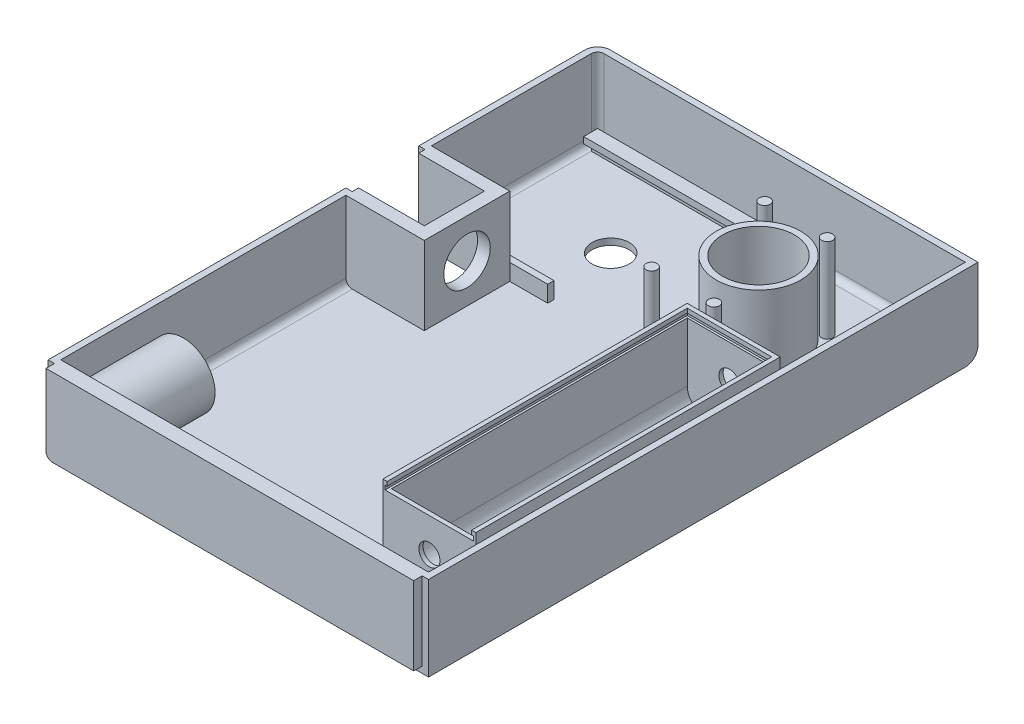
from build123d import *

# Parameters (mm, degrees)
SKETCH1_W            = 90
SKETCH1_H            = 130
BOSS_EXTRUDE1_DEPTH  = 20
FILLET1_R            = 3
SHELL1_T             = -1.5
SKETCH2_W            = 26
SKETCH2_H            = 1.5
SKETCH2_W_2          = 46
SKETCH2_H_2          = 3.3
BOSS_EXTRUDE2_DEPTH  = 3.9
CUT_EXTRUDE1_DEPTH   = 46
SKETCH6_R            = 4.4
CUT_EXTRUDE3_DEPTH   = 1.5
SKETCH8_R            = 10
SKETCH8_R_2          = 8.5
SKETCH8_R_3          = 1.3
BOSS_EXTRUDE7_DEPTH  = 20
CUT_EXTRUDE5_START   = -21.5
SKETCH16_R           = 8.5
CUT_EXTRUDE5_DEPTH   = 21.5
BOSS_EXTRUDE8_START  = -3
SKETCH17_R           = 10
BOSS_EXTRUDE8_DEPTH  = 3
SKETCH18_R           = 10.008571274
CUT_EXTRUDE6_DEPTH   = 3
SKETCH19_R           = 8.5
BOSS_EXTRUDE12_DEPTH = 1
SKETCH20_R           = 1
BOSS_EXTRUDE15_DEPTH = 5.5
SKETCH21_R           = 0.7
BOSS_EXTRUDE16_DEPTH = 3
SKETCH22_W           = 12
SKETCH22_H           = 15.5
CUT_EXTRUDE8_DEPTH   = 0.5
SKETCH23_W           = 15
SKETCH23_H           = 18.5
SKETCH23_W_2         = 12.5
SKETCH23_H_2         = 16
BOSS_EXTRUDE22_DEPTH = 1.5
SKETCH24_W           = 2
SKETCH24_H           = 0.9375
CUT_EXTRUDE11_DEPTH  = 1
SKETCH25_W           = 21.978502557
SKETCH25_H           = 72
SKETCH25_W_2         = 19.978502557
SKETCH25_H_2         = 70
BOSS_EXTRUDE25_DEPTH = 20
FILLET2_R            = 4
CUT_EXTRUDE12_REACH  = 191.679
SKETCH31_R           = 2.5
CUT_EXTRUDE13_REACH  = 174.61
SKETCH32_R           = 2.5
SKETCH34_W           = 20
SKETCH34_H           = 1
CUT_EXTRUDE14_DEPTH  = 2
SKETCH35_W           = 71
SKETCH35_H           = 1
CUT_EXTRUDE15_DEPTH  = 0.5
SKETCH36_W           = 1
SKETCH36_H           = 2
BOSS_EXTRUDE34_DEPTH = 0.021497443
SKETCH38_W           = 71
SKETCH38_H           = 1
CUT_EXTRUDE16_DEPTH  = 0.5
SKETCH39_W           = 20.978502557
SKETCH39_H           = 1
CUT_EXTRUDE17_DEPTH  = 0.5
SKETCH42_R           = 7.5
SKETCH42_R_2         = 6.5
BOSS_EXTRUDE35_DEPTH = 20
SKETCH45_W           = 20
SKETCH45_H           = 17
CUT_EXTRUDE19_DEPTH  = 1.5
SKETCH48_W           = 20.040080506
SKETCH48_H           = 20.038736818
CUT_EXTRUDE20_DEPTH  = 182.842929215
SKETCH49_W           = 20.040080506
SKETCH49_H           = 20
CUT_EXTRUDE22_DEPTH  = 0.184579226
SKETCH52_W           = 20.040080506
SKETCH52_H           = 20.223316044
BOSS_EXTRUDE37_DEPTH = 20
SKETCH54_W           = 18.540080506
SKETCH54_H           = 17.223316044
CUT_EXTRUDE23_DEPTH  = 20
FILLET8_R            = 3
FILLET9_R            = 3
BOSS_EXTRUDE39_DEPTH = 1
SKETCH57_W           = 15.540080506
SKETCH57_H           = 1
BOSS_EXTRUDE40_DEPTH = 1.5
SKETCH58_W           = 17.223316044
SKETCH58_H           = 18.5
BOSS_EXTRUDE41_DEPTH = 1.5
BOSS_EXTRUDE42_START = 1.5
BOSS_EXTRUDE42_DEPTH = 1.5
SKETCH62_W           = 14.040080506
SKETCH62_H           = 1.5
BOSS_EXTRUDE43_DEPTH = 1.5
SKETCH66_W           = 1.5
SKETCH66_H           = 18.5
BOSS_EXTRUDE44_DEPTH = 1.5
SKETCH67_W           = 0.75
SKETCH67_H           = 6
CUT_EXTRUDE24_DEPTH  = 1
FILLET10_R           = 0.25
BOSS_EXTRUDE45_DEPTH = 0.5
CUT_EXTRUDE26_REACH  = 130.535
SKETCH70_R           = 5.5
BOSS_EXTRUDE48_DEPTH = 2
SKETCH74_W           = 87
SKETCH74_H           = 2
BOSS_EXTRUDE49_DEPTH = 1.5


with BuildPart() as part:
    # Sketch1 → Boss-Extrude1 (new body)
    with BuildSketch(Plane(origin=(0, 0, 0), x_dir=(1, 0, 0), z_dir=(0, 1, 0))):
        with Locations((-103.28562659, 38.614544598)):
            Rectangle(SKETCH1_W, SKETCH1_H)
    extrude(amount=BOSS_EXTRUDE1_DEPTH)

    # Fillet1
    fillet1_edges = [part.edges().sort_by_distance(p)[0] for p in [
        (-148.28562659, 0, -38.614544598),
        (-103.28562659, 0, -103.614544598),
        (-148.28562659, 10, -103.614544598),
    ]]
    fillet(fillet1_edges, radius=FILLET1_R)

    # Shell1
    shell1_openings = [part.faces().sort_by_distance(p)[0] for p in [
        (-103.278307477, 20, -38.603923372),
    ]]
    offset(amount=SHELL1_T, openings=shell1_openings, kind=Kind.INTERSECTION)

    # Sketch2 → Boss-Extrude2 (add)
    with BuildSketch(Plane(origin=(0, 1.5, 0), x_dir=(1, 0, 0), z_dir=(0, 1, 0))):
        with Locations((-132.28562659, 63.549123824)):
            Rectangle(SKETCH2_W, SKETCH2_H)
        with Locations((-122.28562659, 98.964544598)):
            Rectangle(SKETCH2_W_2, SKETCH2_H_2)
    extrude(amount=BOSS_EXTRUDE2_DEPTH)

    # 3DSketch3 → Cut-Extrude1 (cut)
    with BuildSketch(Plane(origin=(-99.28562659, 3.9, -97.314544598), x_dir=(0, -0.8000000000000006, -0.5999999999999991), z_dir=(-1, 0, 0))):
        Polygon((0, 0), (1.92, 1.44), (3, 0), (1.08, -1.44), align=None)
    extrude(amount=CUT_EXTRUDE1_DEPTH, mode=Mode.SUBTRACT)

    # Sketch6 → Cut-Extrude3 (cut)
    with BuildSketch(Plane(origin=(0, 1.5, 0), x_dir=(1, 0, 0), z_dir=(0, 1, 0))):
        with Locations(Location((-122.08562659, 80.508056887, 0), (0, 0, 270))):
            Circle(SKETCH6_R)
    extrude(amount=-CUT_EXTRUDE3_DEPTH, mode=Mode.SUBTRACT)

    # Sketch8 → Boss-Extrude7 (add)
    # profile 1 of 5: a face of its own
    with BuildSketch(Plane(origin=(0, 1.5, 0), x_dir=(1, 0, 0), z_dir=(0, 1, 0))):
        with Locations(Location((-87.1062965, 80.508056887, 0), (0, 0, 90))):
            Circle(SKETCH8_R)
        with Locations(Location((-87.1062965, 80.508056887, 0), (0, 0, 270))):
            Circle(SKETCH8_R_2, mode=Mode.SUBTRACT)
    # profile 2 of 5: a face of its own
    with BuildSketch(Plane(origin=(0, 1.5, 0), x_dir=(1, 0, 0), z_dir=(0, 1, 0))):
        with Locations(Location((-94.564129147, 89.408056887, 0), (0, 0, 90))):
            Circle(SKETCH8_R_3)
    # profile 3 of 5: a face of its own
    with BuildSketch(Plane(origin=(0, 1.5, 0), x_dir=(1, 0, 0), z_dir=(0, 1, 0))):
        with Locations(Location((-79.764129147, 89.408056887, 0), (0, 0, 90))):
            Circle(SKETCH8_R_3)
    # profile 4 of 5: a face of its own
    with BuildSketch(Plane(origin=(0, 1.5, 0), x_dir=(1, 0, 0), z_dir=(0, 1, 0))):
        with Locations(Location((-94.502718272, 62.608056887, 0), (0, 0, 90))):
            Circle(SKETCH8_R_3)
    # profile 5 of 5: a face of its own
    with BuildSketch(Plane(origin=(0, 1.5, 0), x_dir=(1, 0, 0), z_dir=(0, 1, 0))):
        with Locations(Location((-79.764129147, 62.608056887, 0), (0, 0, 90))):
            Circle(SKETCH8_R_3)
    extrude(amount=BOSS_EXTRUDE7_DEPTH)

    # Sketch16 → Cut-Extrude5 (cut)
    with BuildSketch(Plane(origin=(0, 21.5, 0), x_dir=(1, 0, 0), z_dir=(0, 1, 0)).offset(CUT_EXTRUDE5_START)):
        with Locations(Location((-87.1062965, 80.508056887, 0), (0, 0, 90))):
            Circle(SKETCH16_R)
    extrude(amount=CUT_EXTRUDE5_DEPTH, mode=Mode.SUBTRACT)

    # Sketch17 → Boss-Extrude8 (add)
    with BuildSketch(Plane(origin=(0, 21.5, 0), x_dir=(1, 0, 0), z_dir=(0, 1, 0)).offset(BOSS_EXTRUDE8_START)):
        with Locations(Location((-87.1062965, 80.508056887, 0), (0, 0, 90))):
            Circle(SKETCH17_R)
    extrude(amount=BOSS_EXTRUDE8_DEPTH)

    # Sketch18 → Cut-Extrude6 (cut)
    with BuildSketch(Plane(origin=(0, 21.5, 0), x_dir=(1, 0, 0), z_dir=(0, 1, 0))):
        with Locations((-87.1062965, 80.508056887)):
            Circle(SKETCH18_R)
    extrude(amount=-CUT_EXTRUDE6_DEPTH, mode=Mode.SUBTRACT)

    # Sketch19 → Boss-Extrude12 (add)
    # profile 1 of 9: a face of its own
    with BuildSketch(Plane.XZ):
        with Locations(Location((-87.1062965, -80.508056887, 0), (0, 0, 270))):
            Circle(SKETCH19_R)
        with BuildLine():
            Line((-81.857714187, -84.342425637), (-84.692082937, -81.508056887))
            Line((-84.692082937, -81.508056887), (-80.68368021, -81.508056887))
            ThreePointArc((-80.68368021, -81.508056887), (-81.101079538, -82.995499197), (-81.857714187, -84.342425637))
        make_face(mode=Mode.SUBTRACT)
        with BuildLine():
            Line((-83.27192775, -85.756639199), (-86.1062965, -82.922270449))
            Line((-86.1062965, -82.922270449), (-86.1062965, -86.930673176))
            ThreePointArc((-86.1062965, -86.930673176), (-84.618854189, -86.513273848), (-83.27192775, -85.756639199))
        make_face(mode=Mode.SUBTRACT)
        with BuildLine():
            Line((-88.1062965, -86.930673176), (-88.1062965, -82.922270449))
            Line((-88.1062965, -82.922270449), (-90.94066525, -85.756639199))
            ThreePointArc((-90.94066525, -85.756639199), (-89.59373881, -86.513273848), (-88.1062965, -86.930673176))
        make_face(mode=Mode.SUBTRACT)
        with BuildLine():
            Line((-84.692082937, -79.508056887), (-80.68368021, -79.508056887))
            ThreePointArc((-80.68368021, -79.508056887), (-81.101079538, -78.020614576), (-81.857714187, -76.673688137))
            Line((-81.857714187, -76.673688137), (-84.692082937, -79.508056887))
        make_face(mode=Mode.SUBTRACT)
        with BuildLine():
            Line((-92.354878812, -84.342425637), (-89.520510062, -81.508056887))
            Line((-89.520510062, -81.508056887), (-93.528912789, -81.508056887))
            ThreePointArc((-93.528912789, -81.508056887), (-93.111513461, -82.995499197), (-92.354878812, -84.342425637))
        make_face(mode=Mode.SUBTRACT)
        with BuildLine():
            Line((-86.1062965, -74.085440597), (-86.1062965, -78.093843324))
            Line((-86.1062965, -78.093843324), (-83.27192775, -75.259474574))
            ThreePointArc((-83.27192775, -75.259474574), (-84.618854189, -74.502839925), (-86.1062965, -74.085440597))
        make_face(mode=Mode.SUBTRACT)
        with BuildLine():
            Line((-90.94066525, -75.259474574), (-88.1062965, -78.093843324))
            Line((-88.1062965, -78.093843324), (-88.1062965, -74.085440597))
            ThreePointArc((-88.1062965, -74.085440597), (-89.59373881, -74.502839925), (-90.94066525, -75.259474574))
        make_face(mode=Mode.SUBTRACT)
        with BuildLine():
            Line((-92.354878812, -76.673688137), (-89.520510062, -79.508056887))
            Line((-89.520510062, -79.508056887), (-93.528912789, -79.508056887))
            ThreePointArc((-93.528912789, -79.508056887), (-93.111513461, -78.020614576), (-92.354878812, -76.673688137))
        make_face(mode=Mode.SUBTRACT)
    # profile 2 of 9: a face of its own
    with BuildSketch(Plane.XZ):
        with BuildLine():
            Line((-80.857714187, -3.83436875), (-83.692082937, -1))
            Line((-83.692082937, -1), (-79.68368021, -1))
            ThreePointArc((-79.68368021, -1), (-80.101079538, -2.48744231), (-80.857714187, -3.83436875))
        make_face()
    # profile 3 of 9: a face of its own
    with BuildSketch(Plane.XZ):
        with BuildLine():
            Line((-82.27192775, -5.248582312), (-85.1062965, -2.414213562))
            Line((-85.1062965, -2.414213562), (-85.1062965, -6.422616289))
            ThreePointArc((-85.1062965, -6.422616289), (-83.618854189, -6.005216961), (-82.27192775, -5.248582312))
        make_face()
    # profile 4 of 9: a face of its own
    with BuildSketch(Plane.XZ):
        with BuildLine():
            Line((-87.1062965, -6.422616289), (-87.1062965, -2.414213562))
            Line((-87.1062965, -2.414213562), (-89.94066525, -5.248582312))
            ThreePointArc((-89.94066525, -5.248582312), (-88.59373881, -6.005216961), (-87.1062965, -6.422616289))
        make_face()
    # profile 5 of 9: a face of its own
    with BuildSketch(Plane.XZ):
        with BuildLine():
            Line((-83.692082937, 1), (-79.68368021, 1))
            ThreePointArc((-79.68368021, 1), (-80.101079538, 2.48744231), (-80.857714187, 3.83436875))
            Line((-80.857714187, 3.83436875), (-83.692082937, 1))
        make_face()
    # profile 6 of 9: a face of its own
    with BuildSketch(Plane.XZ):
        with BuildLine():
            Line((-91.354878812, -3.83436875), (-88.520510062, -1))
            Line((-88.520510062, -1), (-92.528912789, -1))
            ThreePointArc((-92.528912789, -1), (-92.111513461, -2.48744231), (-91.354878812, -3.83436875))
        make_face()
    # profile 7 of 9: a face of its own
    with BuildSketch(Plane.XZ):
        with BuildLine():
            Line((-85.1062965, 6.422616289), (-85.1062965, 2.414213562))
            Line((-85.1062965, 2.414213562), (-82.27192775, 5.248582312))
            ThreePointArc((-82.27192775, 5.248582312), (-83.618854189, 6.005216961), (-85.1062965, 6.422616289))
        make_face()
    # profile 8 of 9: a face of its own
    with BuildSketch(Plane.XZ):
        with BuildLine():
            Line((-89.94066525, 5.248582312), (-87.1062965, 2.414213562))
            Line((-87.1062965, 2.414213562), (-87.1062965, 6.422616289))
            ThreePointArc((-87.1062965, 6.422616289), (-88.59373881, 6.005216961), (-89.94066525, 5.248582312))
        make_face()
    # profile 9 of 9: a face of its own
    with BuildSketch(Plane.XZ):
        with BuildLine():
            Line((-91.354878812, 3.83436875), (-88.520510062, 1))
            Line((-88.520510062, 1), (-92.528912789, 1))
            ThreePointArc((-92.528912789, 1), (-92.111513461, 2.48744231), (-91.354878812, 3.83436875))
        make_face()
    extrude(amount=-BOSS_EXTRUDE12_DEPTH)

    # Sketch20 → Boss-Extrude15 (add)
    with BuildSketch(Plane(origin=(0, 1.5, 0), x_dir=(1, 0, 0), z_dir=(0, 1, 0))):
        with Locations(Location((-69.077904332, 76.031555544, 0), (0, 0, 90))):
            Circle(SKETCH20_R)
    extrude(amount=BOSS_EXTRUDE15_DEPTH)

    # Sketch21 → Boss-Extrude16 (add)
    with BuildSketch(Plane(origin=(0, 7, 0), x_dir=(1, 0, 0), z_dir=(0, 1, 0))):
        with Locations(Location((-69.077904332, 76.031555544, 0), (0, 0, 270))):
            Circle(SKETCH21_R)
    extrude(amount=BOSS_EXTRUDE16_DEPTH)

    # Sketch22 → Cut-Extrude8 (cut)
    with BuildSketch(Plane(origin=(0, 1.5, 0), x_dir=(1, 0, 0), z_dir=(0, 1, 0))):
        with Locations((-69.119914463, 89.382246848)):
            Rectangle(SKETCH22_W, SKETCH22_H)
    extrude(amount=-CUT_EXTRUDE8_DEPTH, mode=Mode.SUBTRACT)

    # Sketch23 → Boss-Extrude22 (add)
    with BuildSketch(Plane(origin=(0, 1.5, 0), x_dir=(1, 0, 0), z_dir=(0, 1, 0))):
        with Locations((-69.119914463, 89.382246848)):
            Rectangle(SKETCH23_W, SKETCH23_H)
        with Locations((-69.119914463, 89.382246848)):
            Rectangle(SKETCH23_W_2, SKETCH23_H_2, mode=Mode.SUBTRACT)
    extrude(amount=BOSS_EXTRUDE22_DEPTH)

    # Sketch24 → Cut-Extrude11 (cut)
    with BuildSketch(Plane(origin=(0, 1, 0), x_dir=(1, 0, 0), z_dir=(0, 1, 0))):
        with Locations((-70.619914463, 96.163496848)):
            Rectangle(SKETCH24_W, SKETCH24_H)
        with Locations((-64.619914463, 96.163496848)):
            Rectangle(SKETCH24_W, SKETCH24_H)
        with Locations((-70.619914463, 94.225996848)):
            Rectangle(SKETCH24_W, SKETCH24_H)
        with Locations((-64.619914463, 94.225996848)):
            Rectangle(SKETCH24_W, SKETCH24_H)
        with Locations((-64.619914463, 92.288496848)):
            Rectangle(SKETCH24_W, SKETCH24_H)
        with Locations((-64.619914463, 90.350996848)):
            Rectangle(SKETCH24_W, SKETCH24_H)
        with Locations((-67.619914463, 92.288496848)):
            Rectangle(SKETCH24_W, SKETCH24_H)
        with Locations((-67.619914463, 90.350996848)):
            Rectangle(SKETCH24_W, SKETCH24_H)
        with Locations((-67.619914463, 96.163496848)):
            Rectangle(SKETCH24_W, SKETCH24_H)
        with Locations((-67.619914463, 94.225996848)):
            Rectangle(SKETCH24_W, SKETCH24_H)
        with Locations((-70.619914463, 92.288496848)):
            Rectangle(SKETCH24_W, SKETCH24_H)
        with Locations((-70.619914463, 90.350996848)):
            Rectangle(SKETCH24_W, SKETCH24_H)
        with Locations((-73.619914463, 90.350996848)):
            Rectangle(SKETCH24_W, SKETCH24_H)
        with Locations((-73.619914463, 92.288496848)):
            Rectangle(SKETCH24_W, SKETCH24_H)
        with Locations((-73.619914463, 94.225996848)):
            Rectangle(SKETCH24_W, SKETCH24_H)
        with Locations((-73.619914463, 96.163496848)):
            Rectangle(SKETCH24_W, SKETCH24_H)
        with Locations((-64.619914463, 88.413496848)):
            Rectangle(SKETCH24_W, SKETCH24_H)
        with Locations((-70.619914463, 88.413496848)):
            Rectangle(SKETCH24_W, SKETCH24_H)
        with Locations((-73.619914463, 82.600996848)):
            Rectangle(SKETCH24_W, SKETCH24_H)
        with Locations((-73.619914463, 84.538496848)):
            Rectangle(SKETCH24_W, SKETCH24_H)
        with Locations((-73.619914463, 86.475996848)):
            Rectangle(SKETCH24_W, SKETCH24_H)
        with Locations((-73.619914463, 88.413496848)):
            Rectangle(SKETCH24_W, SKETCH24_H)
        with Locations((-70.619914463, 86.475996848)):
            Rectangle(SKETCH24_W, SKETCH24_H)
        with Locations((-70.619914463, 84.538496848)):
            Rectangle(SKETCH24_W, SKETCH24_H)
        with Locations((-70.619914463, 82.600996848)):
            Rectangle(SKETCH24_W, SKETCH24_H)
        with Locations((-67.619914463, 82.600996848)):
            Rectangle(SKETCH24_W, SKETCH24_H)
        with Locations((-67.619914463, 84.538496848)):
            Rectangle(SKETCH24_W, SKETCH24_H)
        with Locations((-67.619914463, 86.475996848)):
            Rectangle(SKETCH24_W, SKETCH24_H)
        with Locations((-67.619914463, 88.413496848)):
            Rectangle(SKETCH24_W, SKETCH24_H)
        with Locations((-64.619914463, 86.475996848)):
            Rectangle(SKETCH24_W, SKETCH24_H)
        with Locations((-64.619914463, 84.538496848)):
            Rectangle(SKETCH24_W, SKETCH24_H)
        with Locations((-64.619914463, 82.600996848)):
            Rectangle(SKETCH24_W, SKETCH24_H)
    extrude(amount=-CUT_EXTRUDE11_DEPTH, mode=Mode.SUBTRACT)

    # Sketch25 → Boss-Extrude25 (add)
    with BuildSketch(Plane(origin=(0, 1.5, 0), x_dir=(1, 0, 0), z_dir=(0, 1, 0))):
        with Locations((-71.774877868, 23.308056887)):
            Rectangle(SKETCH25_W, SKETCH25_H)
        with Locations((-71.774877868, 23.308056887)):
            Rectangle(SKETCH25_W_2, SKETCH25_H_2, mode=Mode.SUBTRACT)
    extrude(amount=BOSS_EXTRUDE25_DEPTH)

    # Fillet2
    fillet2_edges = [part.edges().sort_by_distance(p)[0] for p in [
        (-81.764129147, 1.5, -23.308056887),
        (-61.78562659, 1.5, -23.308056887),
    ]]
    fillet(fillet2_edges, radius=FILLET2_R)

    # Sketch31 → Cut-Extrude12 (cut, up to next)
    with BuildSketch(Plane.XY.offset(12.691943113), mode=Mode.PRIVATE) as cut_extrude12_sk1:
        with Locations((-71.774877869, 11.5)):
            Circle(SKETCH31_R)
    cut_extrude12_tool1 = extrude(cut_extrude12_sk1.sketch, amount=-CUT_EXTRUDE12_REACH, mode=Mode.PRIVATE) & part.part
    add(cut_extrude12_tool1.solids().sort_by_distance((-71.774878, 11.5, 12.691943))[0], mode=Mode.SUBTRACT)

    # Sketch32 → Cut-Extrude13 (cut, up to next)
    with BuildSketch(Plane(origin=(0, 0, -59.308056887), x_dir=(-1, 0, 0), z_dir=(0, 0, -1)), mode=Mode.PRIVATE) as cut_extrude13_sk1:
        with Locations(Location((71.774877869, 11.5, 0), (0, 0, 180))):
            Circle(SKETCH32_R)
    cut_extrude13_tool1 = extrude(cut_extrude13_sk1.sketch, amount=-CUT_EXTRUDE13_REACH, mode=Mode.PRIVATE) & part.part
    add(cut_extrude13_tool1.solids().sort_by_distance((-71.774878, 11.5, -59.308057))[0], mode=Mode.SUBTRACT)

    # Sketch34 → Cut-Extrude14 (cut)
    with BuildSketch(Plane(origin=(0, 21.5, 0), x_dir=(1, 0, 0), z_dir=(0, 1, 0))):
        with Locations((-71.764129147, -12.191943113)):
            Rectangle(SKETCH34_W, SKETCH34_H)
    extrude(amount=-CUT_EXTRUDE14_DEPTH, mode=Mode.SUBTRACT)

    # Sketch35 → Cut-Extrude15 (cut)
    with BuildSketch(Plane(origin=(-81.764129147, 0, 0), x_dir=(0, 0, -1), z_dir=(1, 0, 0))):
        with Locations((22.808056887, 20)):
            Rectangle(SKETCH35_W, SKETCH35_H)
    extrude(amount=-CUT_EXTRUDE15_DEPTH, mode=Mode.SUBTRACT)

    # Sketch36 → Boss-Extrude34 (add)
    with BuildSketch(Plane.ZY.offset(61.764129147)):
        with Locations((12.191943113, 20.5)):
            Rectangle(SKETCH36_W, SKETCH36_H)
    extrude(amount=BOSS_EXTRUDE34_DEPTH)

    # Sketch38 → Cut-Extrude16 (cut)
    with BuildSketch(Plane.ZY.offset(61.78562659)):
        with Locations((-22.808056887, 20)):
            Rectangle(SKETCH38_W, SKETCH38_H)
    extrude(amount=-CUT_EXTRUDE16_DEPTH, mode=Mode.SUBTRACT)

    # Sketch39 → Cut-Extrude17 (cut)
    with BuildSketch(Plane.XY.offset(-58.308056887)):
        with Locations((-71.774877868, 20)):
            Rectangle(SKETCH39_W, SKETCH39_H)
    extrude(amount=-CUT_EXTRUDE17_DEPTH, mode=Mode.SUBTRACT)

    # Sketch42 → Boss-Extrude35 (add)
    with BuildSketch(Plane(origin=(0, 0, 24.885455402), x_dir=(-1, 0, 0), z_dir=(0, 0, -1))):
        with Locations(Location((137.78562659, 11.5, 0), (0, 0, 180))):
            Circle(SKETCH42_R)
        with Locations((137.78562659, 11.5)):
            Circle(SKETCH42_R_2, mode=Mode.SUBTRACT)
    extrude(amount=BOSS_EXTRUDE35_DEPTH)

    # Sketch45 → Cut-Extrude19 (cut)
    with BuildSketch(Plane.ZY.offset(148.28562659)):
        with Locations((-52.614544598, 11.5)):
            Rectangle(SKETCH45_W, SKETCH45_H)
    extrude(amount=-CUT_EXTRUDE19_DEPTH, mode=Mode.SUBTRACT)

    # Sketch48 → Cut-Extrude20 (cut, through all)
    with BuildSketch(Plane(origin=(0, 3, 0), x_dir=(1, 0, 0), z_dir=(0, 1, 0))):
        with Locations((-138.265586337, 52.595176189)):
            Rectangle(SKETCH48_W, SKETCH48_H)
    extrude(amount=-CUT_EXTRUDE20_DEPTH, mode=Mode.SUBTRACT)

    # Sketch49 → Cut-Extrude22 (cut)
    with BuildSketch(Plane.XY.offset(-62.614544598)):
        with Locations((-138.265586337, 10)):
            Rectangle(SKETCH49_W, SKETCH49_H)
    extrude(amount=-CUT_EXTRUDE22_DEPTH, mode=Mode.SUBTRACT)

    # Sketch52 → Boss-Extrude37 (add)
    with BuildSketch(Plane(origin=(0, 0, 0), x_dir=(-1, 0, 0), z_dir=(0, -1, 0))):
        with Locations((138.265586337, 52.687465802)):
            Rectangle(SKETCH52_W, SKETCH52_H)
    extrude(amount=-BOSS_EXTRUDE37_DEPTH)

    # Sketch54 → Cut-Extrude23 (cut)
    with BuildSketch(Plane(origin=(0, 20, 0), x_dir=(1, 0, 0), z_dir=(0, 1, 0))):
        with Locations((-139.015586337, 52.687465802)):
            Rectangle(SKETCH54_W, SKETCH54_H)
    extrude(amount=-CUT_EXTRUDE23_DEPTH, mode=Mode.SUBTRACT)

    # Fillet8
    fillet8_edges = [part.edges().sort_by_distance(p)[0] for p in [
        (-148.28562659, 0, -62.049123824),
    ]]
    fillet(fillet8_edges, radius=FILLET8_R)

    # Fillet9
    fillet9_edges = [part.edges().sort_by_distance(p)[0] for p in [
        (-148.28562659, 0, -43.32580778),
    ]]
    fillet(fillet9_edges, radius=FILLET9_R - 0.0001)  # a hair under: the kernel refuses the full size

    # Sketch56 → Boss-Extrude39 (add)
    with BuildSketch(Plane.XY.offset(-61.299123824)):
        with BuildLine():
            Line((-146.78562659, 18.5), (-146.78562659, 3))
            ThreePointArc((-146.78562659, 3), (-146.346286762, 1.939339828), (-145.28562659, 1.5))
            Line((-145.28562659, 1.5), (-131.245546084, 1.5))
            Line((-131.245546084, 1.5), (-131.245546084, 18.5))
            Line((-131.245546084, 18.5), (-146.78562659, 18.5))
        make_face()
    extrude(amount=BOSS_EXTRUDE39_DEPTH)

    # Sketch57 → Boss-Extrude40 (add)
    with BuildSketch(Plane(origin=(0, 18.5, 0), x_dir=(1, 0, 0), z_dir=(0, 1, 0))):
        with Locations((-139.015586337, 60.799123824)):
            Rectangle(SKETCH57_W, SKETCH57_H)
    extrude(amount=BOSS_EXTRUDE40_DEPTH)

    # Sketch58 → Boss-Extrude41 (add)
    with BuildSketch(Plane.ZY.offset(129.745546084)):
        with Locations((-52.687465802, 10.75)):
            Rectangle(SKETCH58_W, SKETCH58_H)
    extrude(amount=BOSS_EXTRUDE41_DEPTH)

    # Sketch59 → Boss-Extrude42 (add)
    with BuildSketch(Plane(origin=(0, 0, -44.07580778), x_dir=(-1, 0, 0), z_dir=(0, 0, -1)).offset(BOSS_EXTRUDE42_START)):
        with BuildLine():
            Line((132.745546084, 18.5), (132.745546084, 1.5))
            Line((132.745546084, 1.5), (145.28562659, 1.5))
            ThreePointArc((145.28562659, 1.5), (146.346286762, 1.939339828), (146.78562659, 3))
            Line((146.78562659, 3), (146.78562659, 18.5))
            Line((146.78562659, 18.5), (132.745546084, 18.5))
        make_face()
    extrude(amount=-BOSS_EXTRUDE42_DEPTH)

    # Sketch62 → Boss-Extrude43 (add)
    with BuildSketch(Plane(origin=(0, 18.5, 0), x_dir=(1, 0, 0), z_dir=(0, 1, 0))):
        with Locations((-139.765586337, 44.82580778)):
            Rectangle(SKETCH62_W, SKETCH62_H)
    extrude(amount=BOSS_EXTRUDE43_DEPTH)

    # Sketch66 → Boss-Extrude44 (add)
    with BuildSketch(Plane(origin=(-132.745546084, 0, 0), x_dir=(0, 0, -1), z_dir=(1, 0, 0))):
        with Locations((44.82580778, 10.75)):
            Rectangle(SKETCH66_W, SKETCH66_H)
    extrude(amount=BOSS_EXTRUDE44_DEPTH)

    # Sketch67 → Cut-Extrude24 (cut)
    with BuildSketch(Plane.XZ.offset(-1.5)):
        with Locations((-130.120546084, -52.687465802)):
            Rectangle(SKETCH67_W, SKETCH67_H)
    extrude(amount=-CUT_EXTRUDE24_DEPTH, mode=Mode.SUBTRACT)

    # Fillet10
    fillet10_edges = [part.edges().sort_by_distance(p)[0] for p in [
        (-130.495546084, 1.5, -52.687465802),
    ]]
    fillet(fillet10_edges, radius=FILLET10_R)

    # Sketch69 → Boss-Extrude45 (add)
    with BuildSketch(Plane.XY.offset(-60.299123824)):
        with BuildLine():
            Line((-131.245546084, 1.5), (-131.245546084, 20))
            Line((-131.245546084, 20), (-146.78562659, 20))
            Line((-146.78562659, 20), (-146.78562659, 3))
            ThreePointArc((-146.78562659, 3), (-146.346286762, 1.939339828), (-145.28562659, 1.5))
            Line((-145.28562659, 1.5), (-131.245546084, 1.5))
        make_face()
    extrude(amount=BOSS_EXTRUDE45_DEPTH)

    # Sketch70 → Cut-Extrude26 (cut, up to next)
    with BuildSketch(Plane.ZY.offset(131.245546084), mode=Mode.PRIVATE) as cut_extrude26_sk1:
        with Locations((-52.687465802, 10.75)):
            Circle(SKETCH70_R)
    cut_extrude26_tool1 = extrude(cut_extrude26_sk1.sketch, amount=-CUT_EXTRUDE26_REACH, mode=Mode.PRIVATE) & part.part
    add(cut_extrude26_tool1.solids().sort_by_distance((-131.245546, 10.75, -52.687466))[0], mode=Mode.SUBTRACT)

    # Sketch73 → Boss-Extrude48 (add)
    with BuildSketch(Plane.XY.offset(26.385455402)):
        with BuildLine():
            Line((-146.78562659, 18.5), (-146.78562659, 3))
            ThreePointArc((-146.78562659, 3), (-146.346286762, 1.939339828), (-145.28562659, 1.5))
            Line((-145.28562659, 1.5), (-59.78562659, 1.5))
            Line((-59.78562659, 1.5), (-59.78562659, 18.5))
            Line((-59.78562659, 18.5), (-146.78562659, 18.5))
        make_face()
    extrude(amount=BOSS_EXTRUDE48_DEPTH)

    # Sketch74 → Boss-Extrude49 (add)
    with BuildSketch(Plane(origin=(0, 18.5, 0), x_dir=(1, 0, 0), z_dir=(0, 1, 0))):
        with Locations((-103.28562659, -27.385455402)):
            Rectangle(SKETCH74_W, SKETCH74_H)
    extrude(amount=BOSS_EXTRUDE49_DEPTH)


solid = part.part
